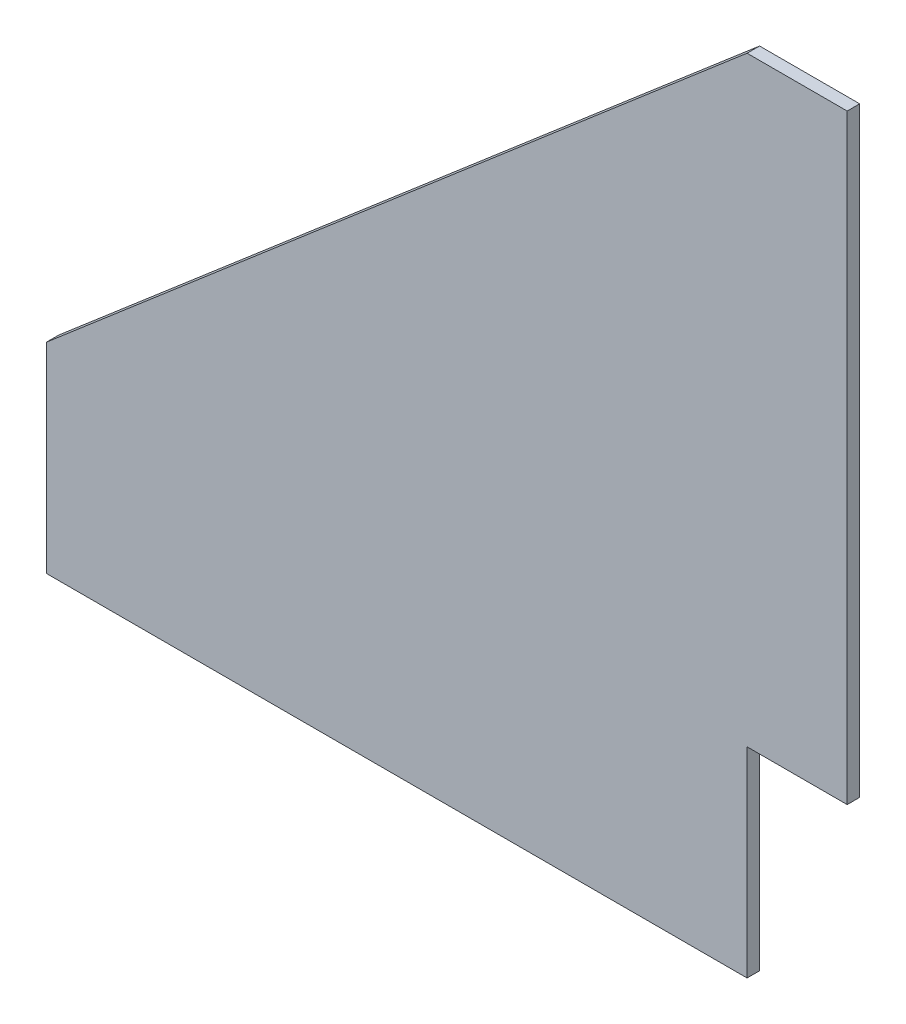
from build123d import *

# Parameters (mm, degrees)
BOSS_EXTRUDE1_DEPTH = 3.175


with BuildPart() as part:
    # Sketch1 → Boss-Extrude1 (new body)
    with BuildSketch(Plane.XY):
        Polygon((0, 0), (0, 152.4), (-25.4, 152.4), (-203.2, 0), (-203.2, -50.8), (-25.4, -50.8), (-25.4, 0), align=None)
    extrude(amount=BOSS_EXTRUDE1_DEPTH)


solid = part.part
